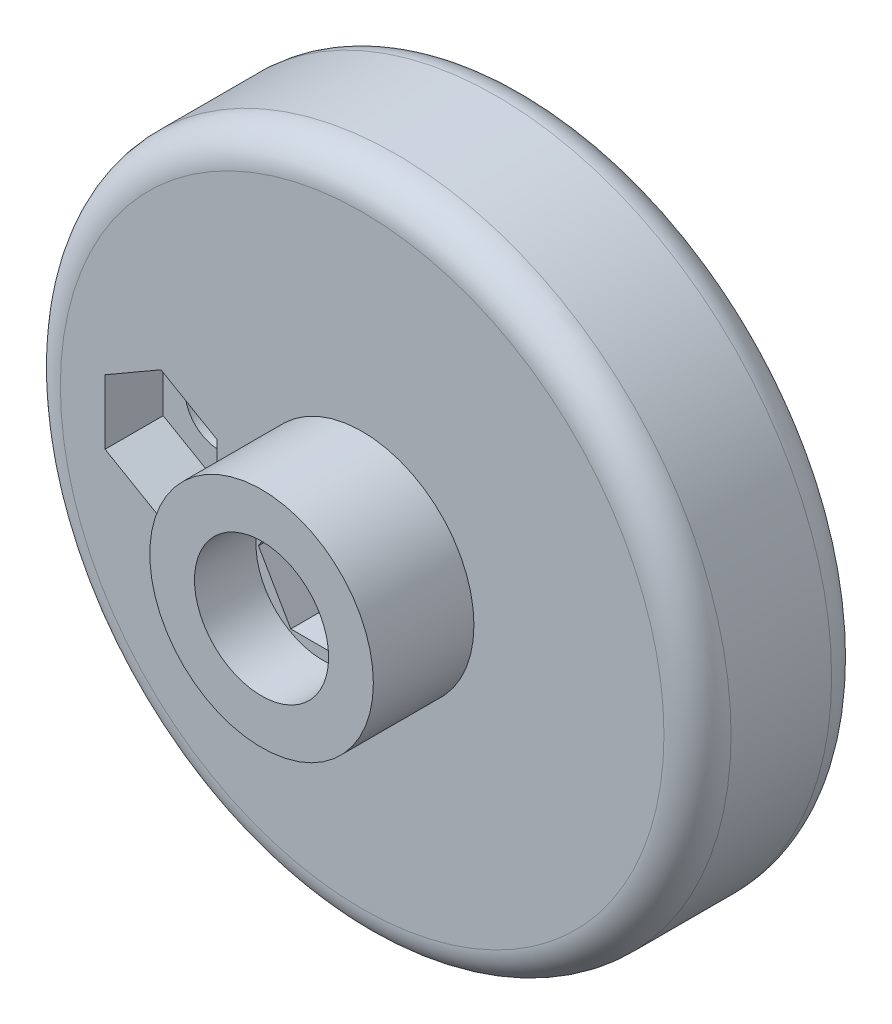
from build123d import *

# Parameters (mm, degrees)
SKETCH1_R           = 30
BOSS_EXTRUDE1_DEPTH = 15
SKETCH2_R           = 10
BOSS_EXTRUDE2_DEPTH = 9
SKETCH3_R           = 3.175
CUT_EXTRUDE1_DEPTH  = 49.744230428
FILLET1_R           = 3
SKETCH4_R           = 6
CUT_EXTRUDE2_DEPTH  = 4
FILLET2_R           = 1
SKETCH8_R           = 3.05
CUT_EXTRUDE3_DEPTH  = 46.000000067
CUT_EXTRUDE4_DEPTH  = 5.2
CUT_EXTRUDE5_START  = -5.5
SKETCH9_R           = 6
CUT_EXTRUDE5_DEPTH  = 5.5
CUT_EXTRUDE6_DEPTH  = 5.5


with BuildPart() as part:
    # Sketch1 → Boss-Extrude1 (new body)
    with BuildSketch(Plane.XY):
        Circle(SKETCH1_R)
    extrude(amount=BOSS_EXTRUDE1_DEPTH)

    # Sketch2 → Boss-Extrude2 (add)
    with BuildSketch(Plane.XY.offset(15)):
        Circle(SKETCH2_R)
    extrude(amount=BOSS_EXTRUDE2_DEPTH)

    # Sketch3 → Cut-Extrude1 (cut, through all)
    with BuildSketch(Plane.XY.offset(24)):
        Circle(SKETCH3_R)
    extrude(amount=-CUT_EXTRUDE1_DEPTH, mode=Mode.SUBTRACT)

    # Fillet1
    fillet1_edges = [part.edges().sort_by_distance(p)[0] for p in [
        (-30, 0, 0),
        (-30, 0, 15),
    ]]
    fillet(fillet1_edges, radius=FILLET1_R)

    # Sketch4 → Cut-Extrude2 (cut)
    with BuildSketch(Plane(origin=(0, 0, 0), x_dir=(-1, 0, 0), z_dir=(0, 0, -1))):
        Circle(SKETCH4_R)
    extrude(amount=-CUT_EXTRUDE2_DEPTH, mode=Mode.SUBTRACT)

    # Fillet2
    fillet2_edges = [part.edges().sort_by_distance(p)[0] for p in [
        (6, 0, 0),
    ]]
    fillet(fillet2_edges, radius=FILLET2_R)

    # Sketch8 → Cut-Extrude3 (cut, through all)
    with BuildSketch(Plane.XY.offset(15)):
        with Locations((-18, 0)):
            Circle(SKETCH8_R)
    extrude(amount=-CUT_EXTRUDE3_DEPTH, mode=Mode.SUBTRACT)

    # Sketch7 → Cut-Extrude4 (cut)
    with BuildSketch(Plane.XY.offset(15)):
        Polygon((-23, 2.886751346), (-23, -2.886751346), (-18, -5.773502692), (-13, -2.886751346), (-13, 2.886751346), (-18, 5.773502692), align=None)
    extrude(amount=-CUT_EXTRUDE4_DEPTH, mode=Mode.SUBTRACT)

    # Sketch9 → Cut-Extrude5 (cut)
    with BuildSketch(Plane.XY.offset(24).offset(CUT_EXTRUDE5_START)):
        Circle(SKETCH9_R)
    extrude(amount=CUT_EXTRUDE5_DEPTH, mode=Mode.SUBTRACT)

    # Sketch10 → Cut-Extrude6 (cut)
    with BuildSketch(Plane.XY.offset(18.5)):
        Polygon((5.773502692, 0), (2.886751346, 5), (-2.886751346, 5), (-5.773502692, 0), (-2.886751346, -5), (2.886751346, -5), align=None)
    extrude(amount=-CUT_EXTRUDE6_DEPTH, mode=Mode.SUBTRACT)


solid = part.part
